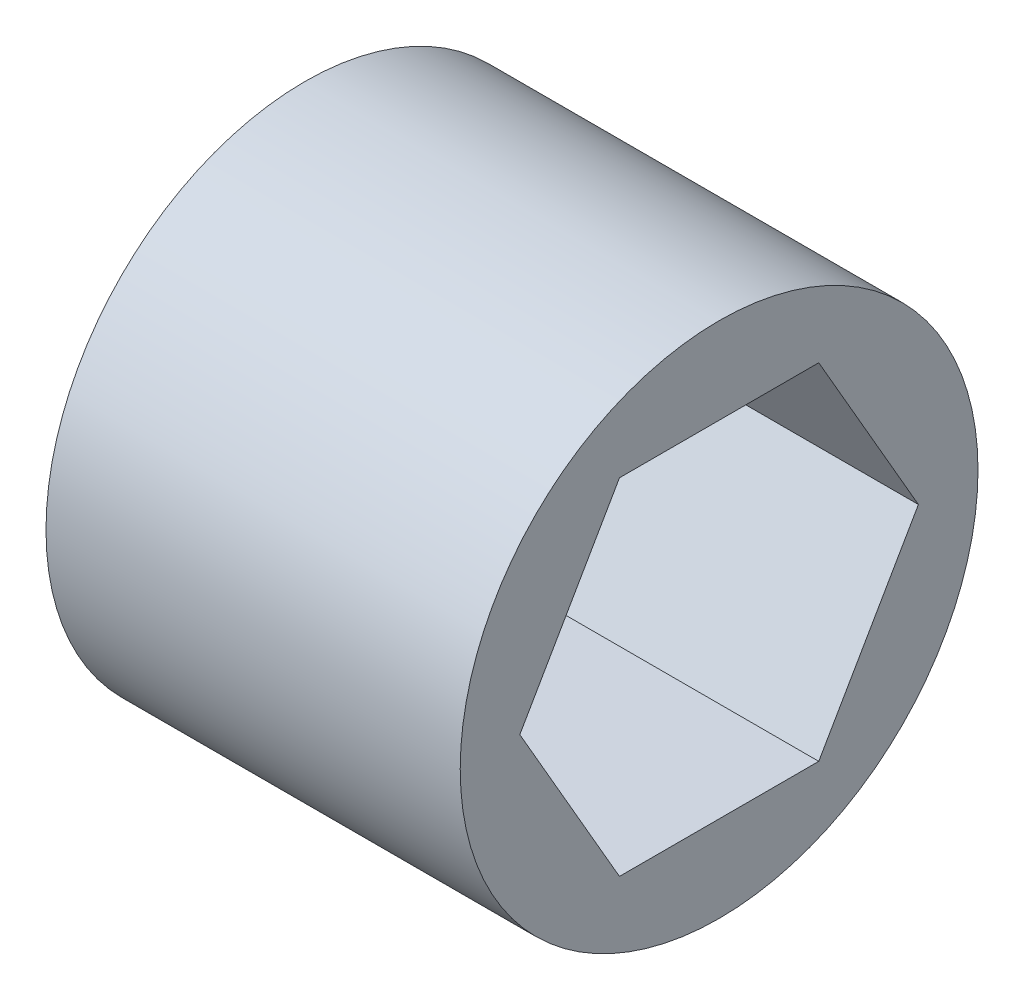
from build123d import *

# Parameters (mm, degrees)
SKETCH1_R           = 9.525
BOSS_EXTRUDE1_DEPTH = 7.62


with BuildPart() as part:
    # Sketch1 → Boss-Extrude1 (new, symmetric)
    with BuildSketch(Plane(origin=(0, 0, 0), x_dir=(0, 0, -1), z_dir=(1, 0, 0))):
        Circle(SKETCH1_R)
        Polygon((7.332348419, 0), (3.666174209, 6.35), (-3.666174209, 6.35), (-7.332348419, 0), (-3.666174209, -6.35), (3.666174209, -6.35), align=None, mode=Mode.SUBTRACT)
    extrude(amount=BOSS_EXTRUDE1_DEPTH, both=True)


solid = part.part
